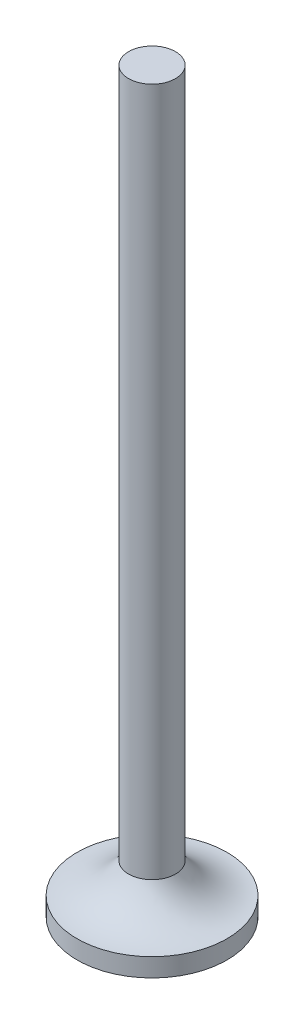
from build123d import *


with BuildPart() as part:
    # Sketch1 → Revolve1 (revolve)
    with BuildSketch(Plane.XY):
        with BuildLine():
            Line((0, 0), (10.16, 0))
            Line((10.16, 0), (10.16, 2.5))
            ThreePointArc((10.16, 2.5), (6.110294408, 3.600733038), (3.175, 6.600028846))
            Line((3.175, 6.600028846), (3.175, 100))
            Line((3.175, 100), (0, 100))
            Line((0, 100), (0, 0))
        make_face()
    revolve(axis=Axis((0, -31.831703756, 0), (0, 1, 0)))


solid = part.part
